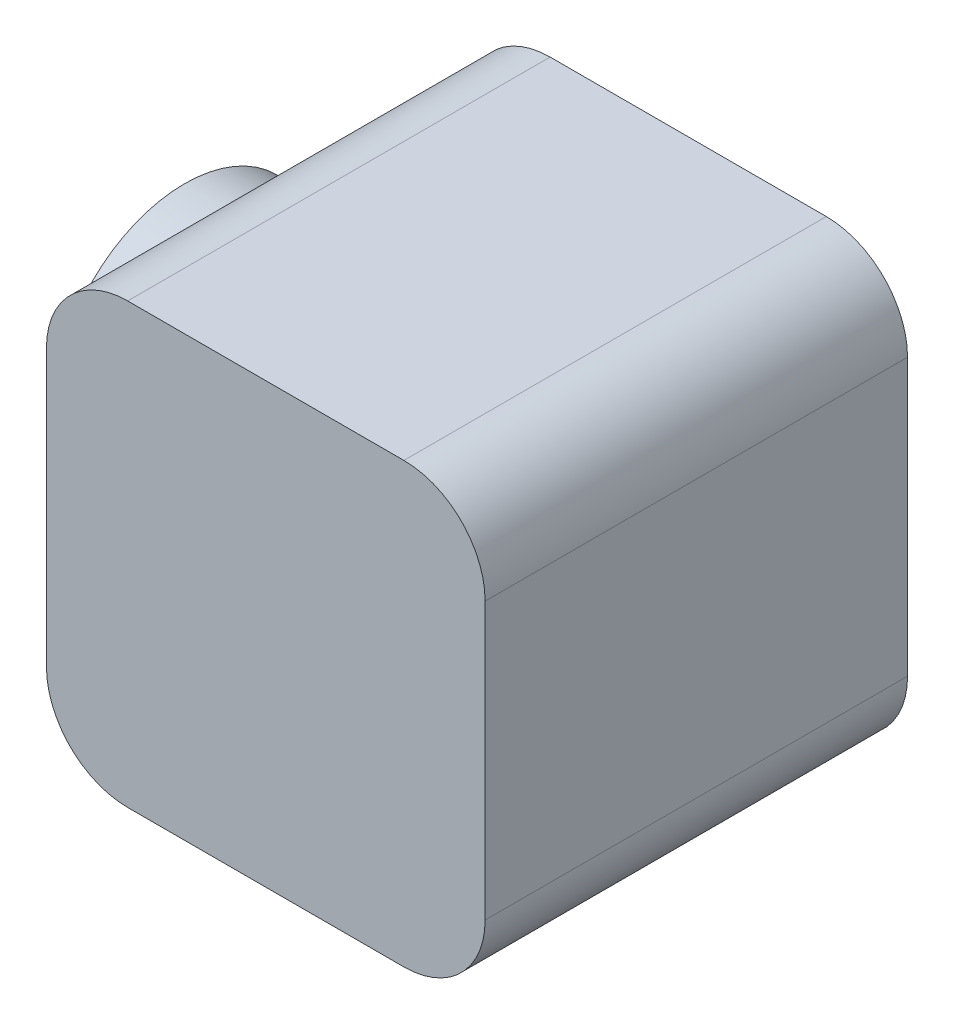
from build123d import *

# Parameters (mm, degrees)
BOSS_EXTRU_5_DEPTH = 25
ESQUISSE7_R        = 8
ESQUISSE7_R_2      = 7.5
BOSS_EXTRU_7_DEPTH = 5
BOSS_EXTRU_6_DEPTH = 1


# Read off the part's stored shape, not the designer's step: Boss.-Extru.5
with BuildPart() as part:
    # Boss.-Extru.5 outline → Boss.-Extru.5 (new body)
    # profile 1 of 2: a face of its own
    with BuildSketch(Plane.XY):
        with BuildLine():
            Line((-8.5, -13.5), (8.5, -13.5))
            ThreePointArc((8.5, -13.5), (12.035533906, -12.035533906), (13.5, -8.5))
            Line((13.5, -8.5), (13.5, 8.5))
            ThreePointArc((13.5, 8.5), (12.035533906, 12.035533906), (8.5, 13.5))
            Line((8.5, 13.5), (-8.5, 13.5))
            ThreePointArc((-8.5, 13.5), (-12.035533906, 12.035533906), (-13.5, 8.5))
            Line((-13.5, 8.5), (-13.5, -8.5))
            ThreePointArc((-13.5, -8.5), (-12.035533906, -12.035533906), (-8.5, -13.5))
        make_face()
        with BuildLine():
            Line((-10, 3.5), (-10, 8.5))
            ThreePointArc((-10, 8.5), (-9.560660172, 9.560660172), (-8.5, 10))
            Line((-8.5, 10), (-3.5, 10))
            Line((-3.5, 10), (-3.5, 9.5))
            Line((-3.5, 9.5), (-3, 9.5))
            Line((-3, 9.5), (-3, 8.5))
            Line((-3, 8.5), (-6, 8.5))
            Line((-6, 8.5), (-6, 7.060660172))
            Line((-6, 7.060660172), (-3.439339828, 4.5))
            Line((-3.439339828, 4.5), (-0.866025404, 4.5))
            Line((-0.866025404, 4.5), (0, 4))
            Line((0, 4), (0.866025404, 4.5))
            Line((0.866025404, 4.5), (3.439339828, 4.5))
            Line((3.439339828, 4.5), (6, 7.060660172))
            Line((6, 7.060660172), (6, 8.5))
            Line((6, 8.5), (3, 8.5))
            Line((3, 8.5), (3, 9.5))
            Line((3, 9.5), (3.5, 9.5))
            Line((3.5, 9.5), (3.5, 10))
            Line((3.5, 10), (8.5, 10))
            ThreePointArc((8.5, 10), (9.560660172, 9.560660172), (10, 8.5))
            Line((10, 8.5), (10, 3.5))
            Line((10, 3.5), (9.5, 3.5))
            Line((9.5, 3.5), (9.5, 3))
            Line((9.5, 3), (8.5, 3))
            Line((8.5, 3), (8.5, 6))
            Line((8.5, 6), (7.060660172, 6))
            Line((7.060660172, 6), (4.5, 3.439339828))
            Line((4.5, 3.439339828), (4.5, 0.866025404))
            Line((4.5, 0.866025404), (4, 0))
            Line((4, 0), (4.5, -0.866025404))
            Line((4.5, -0.866025404), (4.5, -3.439339828))
            Line((4.5, -3.439339828), (7.060660172, -6))
            Line((7.060660172, -6), (8.5, -6))
            Line((8.5, -6), (8.5, -3))
            Line((8.5, -3), (9.5, -3))
            Line((9.5, -3), (9.5, -3.5))
            Line((9.5, -3.5), (10, -3.5))
            Line((10, -3.5), (10, -8.5))
            ThreePointArc((10, -8.5), (9.560660172, -9.560660172), (8.5, -10))
            Line((8.5, -10), (3.5, -10))
            Line((3.5, -10), (3.5, -9.5))
            Line((3.5, -9.5), (3, -9.5))
            Line((3, -9.5), (3, -8.5))
            Line((3, -8.5), (6, -8.5))
            Line((6, -8.5), (6, -7.060660172))
            Line((6, -7.060660172), (3.439339828, -4.5))
            Line((3.439339828, -4.5), (0.866025404, -4.5))
            Line((0.866025404, -4.5), (0, -4))
            Line((0, -4), (-0.866025404, -4.5))
            Line((-0.866025404, -4.5), (-3.439339828, -4.5))
            Line((-3.439339828, -4.5), (-6, -7.060660172))
            Line((-6, -7.060660172), (-6, -8.5))
            Line((-6, -8.5), (-3, -8.5))
            Line((-3, -8.5), (-3, -9.5))
            Line((-3, -9.5), (-3.5, -9.5))
            Line((-3.5, -9.5), (-3.5, -10))
            Line((-3.5, -10), (-8.5, -10))
            ThreePointArc((-8.5, -10), (-9.560660172, -9.560660172), (-10, -8.5))
            Line((-10, -8.5), (-10, -3.5))
            Line((-10, -3.5), (-9.5, -3.5))
            Line((-9.5, -3.5), (-9.5, -3))
            Line((-9.5, -3), (-8.5, -3))
            Line((-8.5, -3), (-8.5, -6))
            Line((-8.5, -6), (-7.060660172, -6))
            Line((-7.060660172, -6), (-4.5, -3.439339828))
            Line((-4.5, -3.439339828), (-4.5, -0.866025404))
            Line((-4.5, -0.866025404), (-4, 0))
            Line((-4, 0), (-4.5, 0.866025404))
            Line((-4.5, 0.866025404), (-4.5, 3.439339828))
            Line((-4.5, 3.439339828), (-7.060660172, 6))
            Line((-7.060660172, 6), (-8.5, 6))
            Line((-8.5, 6), (-8.5, 3))
            Line((-8.5, 3), (-9.5, 3))
            Line((-9.5, 3), (-9.5, 3.5))
            Line((-9.5, 3.5), (-10, 3.5))
        make_face(mode=Mode.SUBTRACT)
    # profile 2 of 2: a face of its own
    with BuildSketch(Plane.XY):
        with BuildLine():
            Line((1.949592103, 3.000876196), (1.276279893, 2.435900169))
            ThreePointArc((1.276279893, 2.435900169), (0.001756003, 2.749999439), (-1.273167982, 2.43752811))
            Line((-1.273167982, 2.43752811), (-1.947287092, 3.003181207))
            Line((-1.947287092, 3.003181207), (-3.000876196, 1.949592103))
            Line((-3.000876196, 1.949592103), (-2.435900169, 1.276279893))
            ThreePointArc((-2.435900169, 1.276279893), (-2.749999439, 0.001756003), (-2.43752811, -1.273167982))
            Line((-2.43752811, -1.273167982), (-3.003181207, -1.947287092))
            Line((-3.003181207, -1.947287092), (-1.949592103, -3.000876196))
            Line((-1.949592103, -3.000876196), (-1.276279893, -2.435900169))
            ThreePointArc((-1.276279893, -2.435900169), (-0.001756003, -2.749999439), (1.273167982, -2.43752811))
            Line((1.273167982, -2.43752811), (1.947287092, -3.003181207))
            Line((1.947287092, -3.003181207), (3.000876196, -1.949592103))
            Line((3.000876196, -1.949592103), (2.435900169, -1.276279893))
            ThreePointArc((2.435900169, -1.276279893), (2.749999439, -0.001756003), (2.43752811, 1.273167982))
            Line((2.43752811, 1.273167982), (3.003181207, 1.947287092))
            Line((3.003181207, 1.947287092), (1.949592103, 3.000876196))
        make_face()
    extrude(amount=BOSS_EXTRU_5_DEPTH)

    # Esquisse7 → Boss.-Extru.7 (add)
    with BuildSketch(Plane.ZY.offset(13.5)):
        with Locations(Location((12.5, 0, 0), (0, 0, 180))):
            Circle(ESQUISSE7_R)
        with Locations((12.5, 0)):
            Circle(ESQUISSE7_R_2, mode=Mode.SUBTRACT)
    extrude(amount=BOSS_EXTRU_7_DEPTH)

    # Esquisse6 → Boss.-Extru.6 (add)
    with BuildSketch(Plane.XY.offset(25)):
        with BuildLine():
            Line((-13.5, 8.5), (-13.5, -8.5))
            ThreePointArc((-13.5, -8.5), (-12.035533906, -12.035533906), (-8.5, -13.5))
            Line((-8.5, -13.5), (8.5, -13.5))
            ThreePointArc((8.5, -13.5), (12.035533906, -12.035533906), (13.5, -8.5))
            Line((13.5, -8.5), (13.5, 8.5))
            ThreePointArc((13.5, 8.5), (12.035533906, 12.035533906), (8.5, 13.5))
            Line((8.5, 13.5), (-8.5, 13.5))
            ThreePointArc((-8.5, 13.5), (-12.035533906, 12.035533906), (-13.5, 8.5))
        make_face()
    extrude(amount=BOSS_EXTRU_6_DEPTH)


solid = part.part
